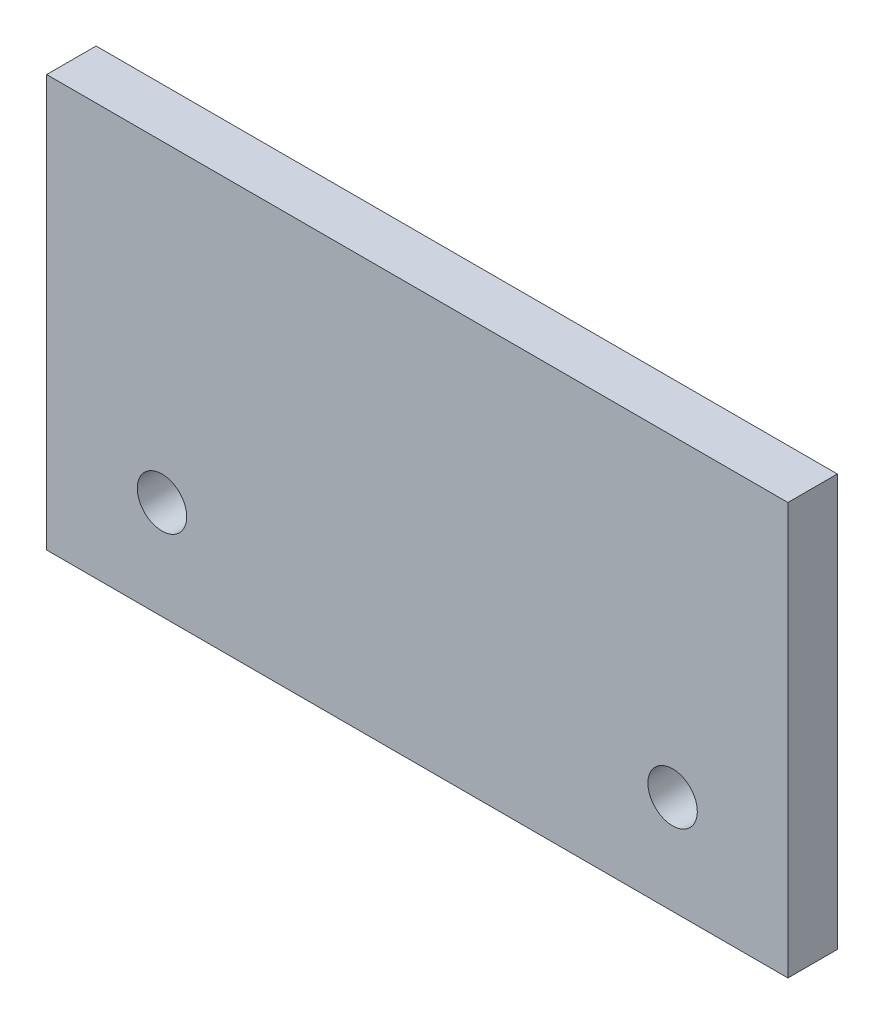
from build123d import *

# Parameters (mm, degrees)
CROQUIS1_W              = 45
CROQUIS1_H              = 25
CROQUIS1_R              = 1.5
SALIENTE_EXTRUIR1_DEPTH = 3


with BuildPart() as part:
    # Croquis1 → Saliente-Extruir1 (new body)
    with BuildSketch(Plane.XY):
        Rectangle(CROQUIS1_W, CROQUIS1_H)
        with Locations((15.5, -6.5)):
            Circle(CROQUIS1_R, mode=Mode.SUBTRACT)
        with Locations((-15.5, -6.5)):
            Circle(CROQUIS1_R, mode=Mode.SUBTRACT)
    extrude(amount=SALIENTE_EXTRUIR1_DEPTH)


solid = part.part
